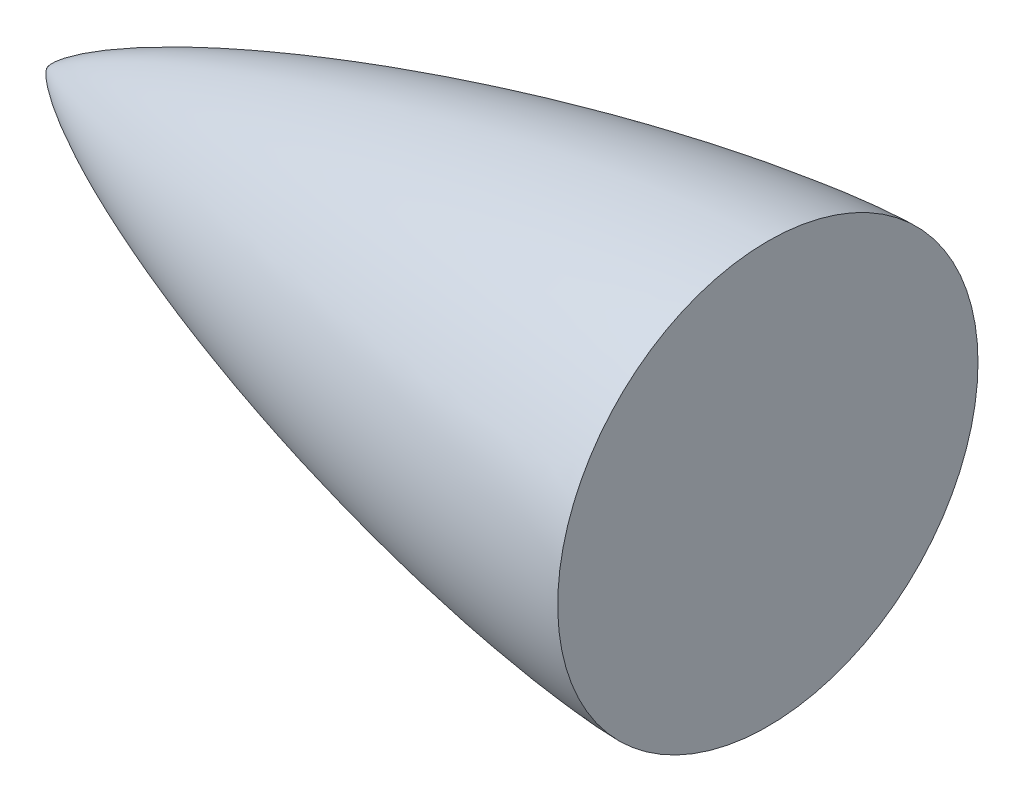
from build123d import *


with BuildPart() as part:
    # Sketch1 → Revolve1 (revolve)
    with BuildSketch(Plane.XY):
        with BuildLine():
            Line((304.8, 88.915147431), (304.8, 0))
            Line((304.8, 0), (0, 0))
            add(Edge.make_bspline(
                [(0, 0), (0.00154476, 0.011943061), (0.005665604, 0.035617436), (0.018231016, 0.082091604), (0.050035381, 0.172924349), (0.093748032, 0.272802943), (0.148222756, 0.381633627), (0.233839147, 0.537104533), (0.373210062, 0.765966107), (0.638470836, 1.148535584), (1.139458703, 1.772744335), (2.024732799, 2.726203123), (3.543267594, 4.142040552), (6.105421279, 6.218529648), (10.307344416, 9.183461683), (16.463660944, 12.982254657), (26.350204661, 18.387271976), (39.671854862, 24.77215502), (55.780355034, 31.645979032), (74.255809202, 38.732400736), (92.929358562, 45.274612986), (111.759981347, 51.348931512), (130.720270912, 57.00393138), (149.792780799, 62.267772154), (168.964828067, 67.156133205), (188.227801851, 71.673003593), (207.575455535, 75.812455425), (227.003724333, 79.556101817), (246.510143879, 82.870623996), (263.645934371, 85.343097937), (278.382610089, 87.091004418), (289.37600533, 88.103225399), (296.026282864, 88.57415268), (300.787350377, 88.812128524), (303.079898902, 88.887720625), (304.226566518, 88.912010181), (304.8, 88.915147431)],
                knots=[0, 0, 0, 0, 0, 0.000149706, 0.000299412, 0.000598825, 0.00119765, 0.001506159, 0.001814668, 0.002808926, 0.004533503, 0.007299516, 0.011774895, 0.018998982, 0.030370009, 0.048342283, 0.075779628, 0.109043107, 0.170642388, 0.23224167, 0.293840979, 0.35544028, 0.417039579, 0.478638886, 0.540238188, 0.60183749, 0.663436794, 0.725036098, 0.786635405, 0.848234712, 0.909834018, 0.940633671, 0.971433324, 0.985716662, 0.992858331, 1, 1, 1, 1, 1], degree=4))
        make_face()
    revolve(axis=Axis((304.8, 0, 0), (-1, 0, 0)))


solid = part.part
